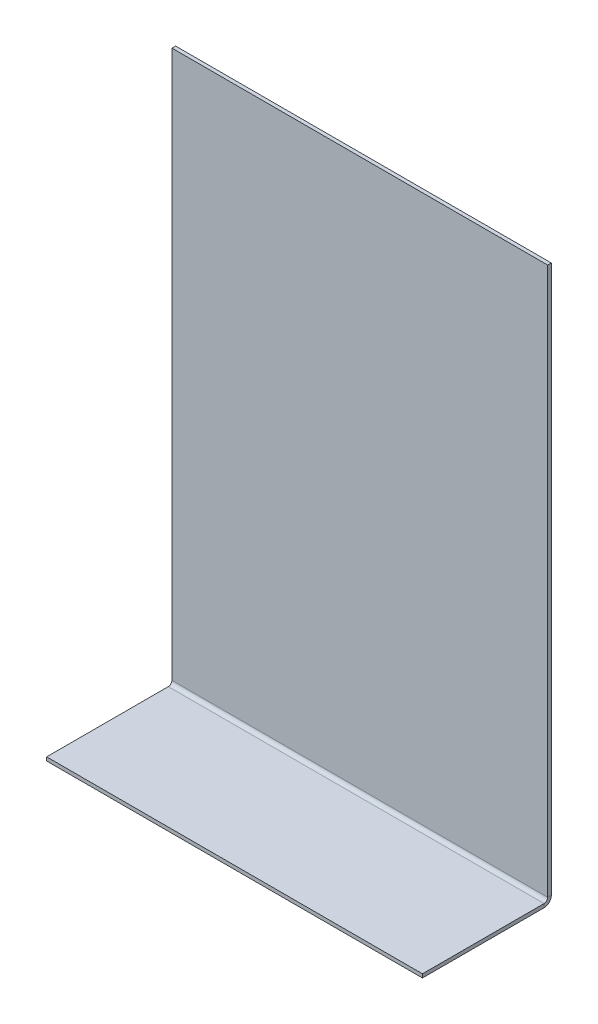
from build123d import *

# Parameters (mm, degrees)
SKETCH1_W                    = 76.2
SKETCH1_H                    = 25.4
BASE_FLANGE1_DEPTH           = 0.7366
EDGE_FLANGE1_STRIP_W         = 4.4196
EDGE_FLANGE1_STRIP_H         = 0.7366
EDGE_FLANGE1_STRIP_CUT_DEPTH = 76.2
EDGE_FLANGE1_DEPTH           = 76.2


# Sheet-metal steps are written as plain solids
with BuildPart() as part:
    # Sketch1 → Base-Flange1 (new body)
    with BuildSketch(Plane(origin=(0, 0, 0), x_dir=(1, 0, 0), z_dir=(0, 1, 0))):
        with Locations((38.1, 12.7)):
            Rectangle(SKETCH1_W, SKETCH1_H)
    extrude(amount=-BASE_FLANGE1_DEPTH)

    # Edge-Flange1 strip (across the edge) → Edge-Flange1 strip cut (cut)
    with BuildSketch(Plane(origin=(76.2, 0, -25.4), x_dir=(0, 0, 1), z_dir=(-1, 0, 0))):
        with Locations((-1.4732, -0.3683)):
            Rectangle(EDGE_FLANGE1_STRIP_W, EDGE_FLANGE1_STRIP_H)
    extrude(amount=EDGE_FLANGE1_STRIP_CUT_DEPTH, mode=Mode.SUBTRACT)

    # Edge-Flange1 section (across the edge) → Edge-Flange1 (add)
    with BuildSketch(Plane(origin=(76.2, 0, -25.4), x_dir=(0, 0, 1), z_dir=(-1, 0, 0))):
        with BuildLine():
            Line((-0.7366, 0.7366), (-0.7366, 111.76))
            Line((-0.7366, 111.76), (0, 111.76))
            Line((0, 111.76), (0, 0.7366))
            ThreePointArc((0, 0.7366), (0.215745145, 0.215745145), (0.7366, 0))
            Line((0.7366, 0), (0.7366, -0.7366))
            ThreePointArc((0.7366, -0.7366), (-0.30510971, -0.30510971), (-0.7366, 0.7366))
        make_face()
    extrude(amount=EDGE_FLANGE1_DEPTH)


solid = part.part
